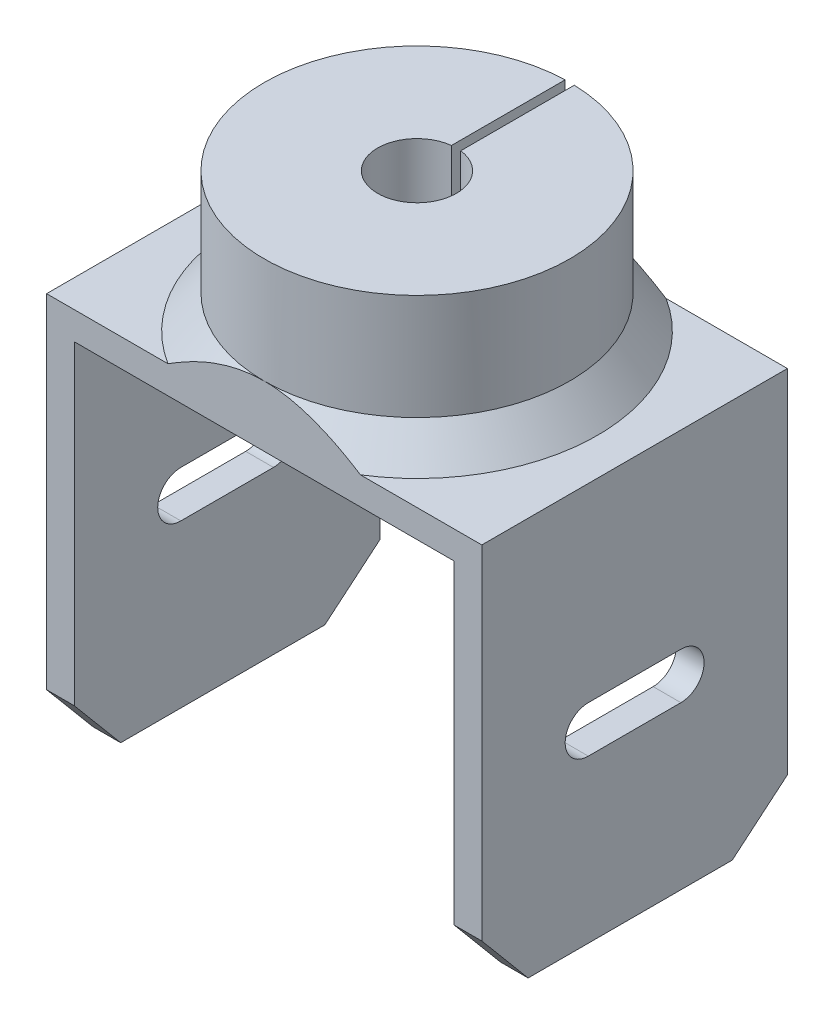
from build123d import *
from OCP.BRepFilletAPI import BRepFilletAPI_MakeChamfer

# Parameters (mm, degrees)
BOSS_EXTRUDE1_DEPTH     = 33
CUT_EXTRUDE2_DEPTH      = 70.814038703
CUT_EXTRUDE2_DEPTH_BACK = 70.814038703
SKETCH5_R               = 16.5
SKETCH5_R_2             = 4.25
BOSS_EXTRUDE2_DEPTH     = 15
CHAMFER1_SIZE           = 3
CHAMFER1_SIZE_2         = 3.575260778
CUT_EXTRUDE_THIN1_START = -15
SKETCH6_W               = 1
SKETCH6_H               = 51.277142369
CUT_EXTRUDE_THIN1_DEPTH = 15
CHAMFER2_SIZE           = 5
CHAMFER2_SIZE2          = 5.958767963


with BuildPart() as part:
    # Sketch1 → Boss-Extrude1 (new body)
    with BuildSketch(Plane.XY):
        Polygon((0, 0), (0, 40), (41, 40), (41, 0), (44, 0), (44, 43), (-3, 43), (-3, 0), align=None)
    extrude(amount=BOSS_EXTRUDE1_DEPTH)

    # Sketch4 → Cut-Extrude2 (cut, two sides: drawn at the far end of the back side and taken through both)
    with BuildSketch(Plane(origin=(0, 0, 0), x_dir=(0, 0, -1), z_dir=(1, 0, 0)).offset(-CUT_EXTRUDE2_DEPTH_BACK)):
        with BuildLine():
            Line((-21.5, 22.5), (-11.5, 22.5))
            ThreePointArc((-11.5, 22.5), (-9, 20), (-11.5, 17.5))
            Line((-11.5, 17.5), (-21.5, 17.5))
            ThreePointArc((-21.5, 17.5), (-24, 20), (-21.5, 22.5))
        make_face()
    extrude(amount=CUT_EXTRUDE2_DEPTH + CUT_EXTRUDE2_DEPTH_BACK, mode=Mode.SUBTRACT)

    # Sketch5 → Boss-Extrude2 (add)
    with BuildSketch(Plane(origin=(0, 43, 0), x_dir=(1, 0, 0), z_dir=(0, 1, 0))):
        with Locations(Location((20.5, -16.5, 0), (0, 0, 270))):
            Circle(SKETCH5_R)
        with Locations(Location((20.5, -16.5, 0), (0, 0, 270))):
            Circle(SKETCH5_R_2, mode=Mode.SUBTRACT)
    extrude(amount=BOSS_EXTRUDE2_DEPTH)

    # Chamfer1
    # the kernel refuses this chamfer: 3.575260778, 3 mm, written as the material it adds along each edge
    with BuildSketch(Plane(origin=(20.5, 43, 16.5), x_dir=(0, 0, -1), z_dir=(1, 0, 0))) as chamfer1_piece_1_section:
        Polygon((16.5 + CHAMFER1_SIZE, 0), (16.5, CHAMFER1_SIZE_2), (16.5, 0), align=None)
    chamfer1_piece_1 = revolve(axis=Axis((20.5, 43, 16.5), (0, 1, 0)), revolution_arc=180, mode=Mode.PRIVATE)
    chamfer1_piece_1 = split(chamfer1_piece_1, bisect_by=Plane(origin=(2.547299358, 44.747941515, 0), z_dir=(0, 0, 1)), keep=Keep.TOP, mode=Mode.PRIVATE)
    chamfer1_piece_1 = split(chamfer1_piece_1, bisect_by=Plane(origin=(2.547299358, 44.747941515, 33), z_dir=(0, 0, -1)), keep=Keep.TOP, mode=Mode.PRIVATE)
    add(chamfer1_piece_1)
    with BuildSketch(Plane(origin=(20.5, 43, 16.5), x_dir=(0, 0, 1), z_dir=(-1, 0, 0))) as chamfer1_piece_2_section:
        Polygon((16.5 + CHAMFER1_SIZE, 0), (16.5, CHAMFER1_SIZE_2), (16.5, 0), align=None)
    chamfer1_piece_2 = revolve(axis=Axis((20.5, 43, 16.5), (0, 1, 0)), revolution_arc=180, mode=Mode.PRIVATE)
    chamfer1_piece_2 = split(chamfer1_piece_2, bisect_by=Plane(origin=(38.452700642, 44.747941515, 0), z_dir=(0, 0, 1)), keep=Keep.TOP, mode=Mode.PRIVATE)
    chamfer1_piece_2 = split(chamfer1_piece_2, bisect_by=Plane(origin=(38.452700642, 44.747941515, 33), z_dir=(0, 0, -1)), keep=Keep.TOP, mode=Mode.PRIVATE)
    add(chamfer1_piece_2)

    # Sketch6 → Cut-Extrude-Thin1 (cut)
    with BuildSketch(Plane(origin=(0, 58, 0), x_dir=(1, 0, 0), z_dir=(0, 1, 0)).offset(CUT_EXTRUDE_THIN1_START)):
        with Locations((20.5, 9.138571185)):
            Rectangle(SKETCH6_W, SKETCH6_H)
    extrude(amount=CUT_EXTRUDE_THIN1_DEPTH, mode=Mode.SUBTRACT)

    # Chamfer2: one chamfer whose edges measure the first distance from different faces: ONE call of the kernel's chamfer builder (chamfer() names one face for all edges)
    chamfer2_edges_1 = [part.edges().sort_by_distance(p)[0] for p in [
        (-1.5, 0, 0),
        (42.5, 0, 0),
    ]]
    chamfer2_side_1 = [part.faces().sort_by_distance(p)[0] for p in [
        (25.936545793, 44.827539599, 0),
    ]]
    chamfer2_edges_2 = [part.edges().sort_by_distance(p)[0] for p in [
        (42.5, 0, 33),
    ]]
    chamfer2_side_2 = [part.faces().sort_by_distance(p)[0] for p in [
        (42.5, 0, 16.5),
    ]]
    chamfer2_edges_3 = [part.edges().sort_by_distance(p)[0] for p in [
        (-1.5, 0, 33),
    ]]
    chamfer2_side_3 = [part.faces().sort_by_distance(p)[0] for p in [
        (-1.5, 0, 16.5),
    ]]
    chamfer2 = BRepFilletAPI_MakeChamfer(part.part.solid().wrapped)
    for e in chamfer2_edges_1:
        chamfer2.Add(CHAMFER2_SIZE, CHAMFER2_SIZE2, e.wrapped, chamfer2_side_1[0].wrapped)  # the first distance lies on this face
    for e in chamfer2_edges_2:
        chamfer2.Add(CHAMFER2_SIZE, CHAMFER2_SIZE2, e.wrapped, chamfer2_side_2[0].wrapped)  # the first distance lies on this face
    for e in chamfer2_edges_3:
        chamfer2.Add(CHAMFER2_SIZE, CHAMFER2_SIZE2, e.wrapped, chamfer2_side_3[0].wrapped)  # the first distance lies on this face
    add(Compound.cast(chamfer2.Shape()), mode=Mode.REPLACE)


solid = part.part
